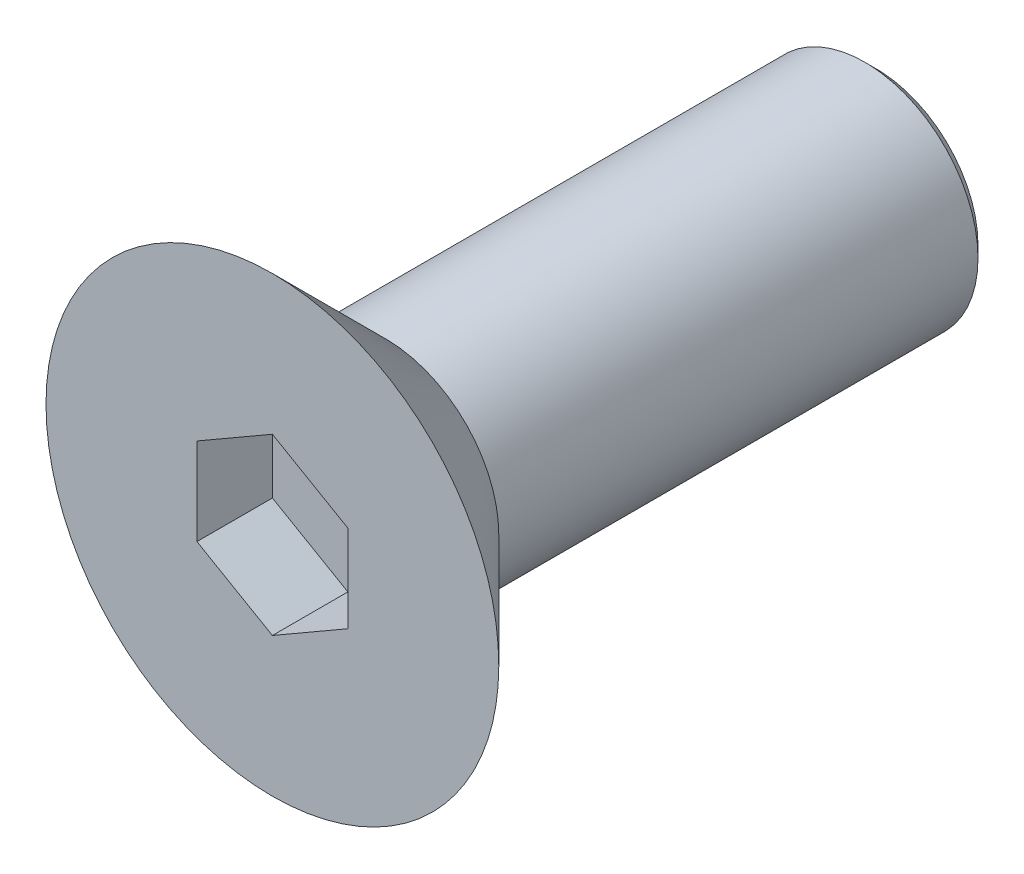
from build123d import *

# Parameters (mm, degrees)
SKETCH1_R           = 6
BOSS_EXTRUDE1_DEPTH = 3
SKETCH2_R           = 3
BOSS_EXTRUDE2_DEPTH = 13
CHAMFER1_SIZE       = 0.3
CUT_EXTRUDE1_DEPTH  = 2
CHAMFER2_SIZE       = 3


with BuildPart() as part:
    # Sketch1 → Boss-Extrude1 (new body)
    with BuildSketch(Plane.XY):
        Circle(SKETCH1_R)
    extrude(amount=BOSS_EXTRUDE1_DEPTH)

    # Sketch2 → Boss-Extrude2 (add)
    with BuildSketch(Plane(origin=(0, 0, 0), x_dir=(-1, 0, 0), z_dir=(0, 0, -1))):
        with Locations(Location((0, 0, 0), (0, 0, 180))):
            Circle(SKETCH2_R)
    extrude(amount=BOSS_EXTRUDE2_DEPTH)

    # Chamfer1
    chamfer1_edges = [part.edges().sort_by_distance(p)[0] for p in [
        (-3, 0, -13),
    ]]
    chamfer(chamfer1_edges, length=CHAMFER1_SIZE)

    # Sketch3 → Cut-Extrude1 (cut)
    with BuildSketch(Plane.XY.offset(3)):
        Polygon((0, 2.309401077), (-2, 1.154700538), (-2, -1.154700538), (0, -2.309401077), (2, -1.154700538), (2, 1.154700538), align=None)
    extrude(amount=-CUT_EXTRUDE1_DEPTH, mode=Mode.SUBTRACT)

    # Chamfer2
    chamfer2_edges = [part.edges().sort_by_distance(p)[0] for p in [
        (-6, 0, 0),
    ]]
    chamfer(chamfer2_edges, length=CHAMFER2_SIZE - 0.0001)  # a hair under: the kernel refuses the full size


solid = part.part
